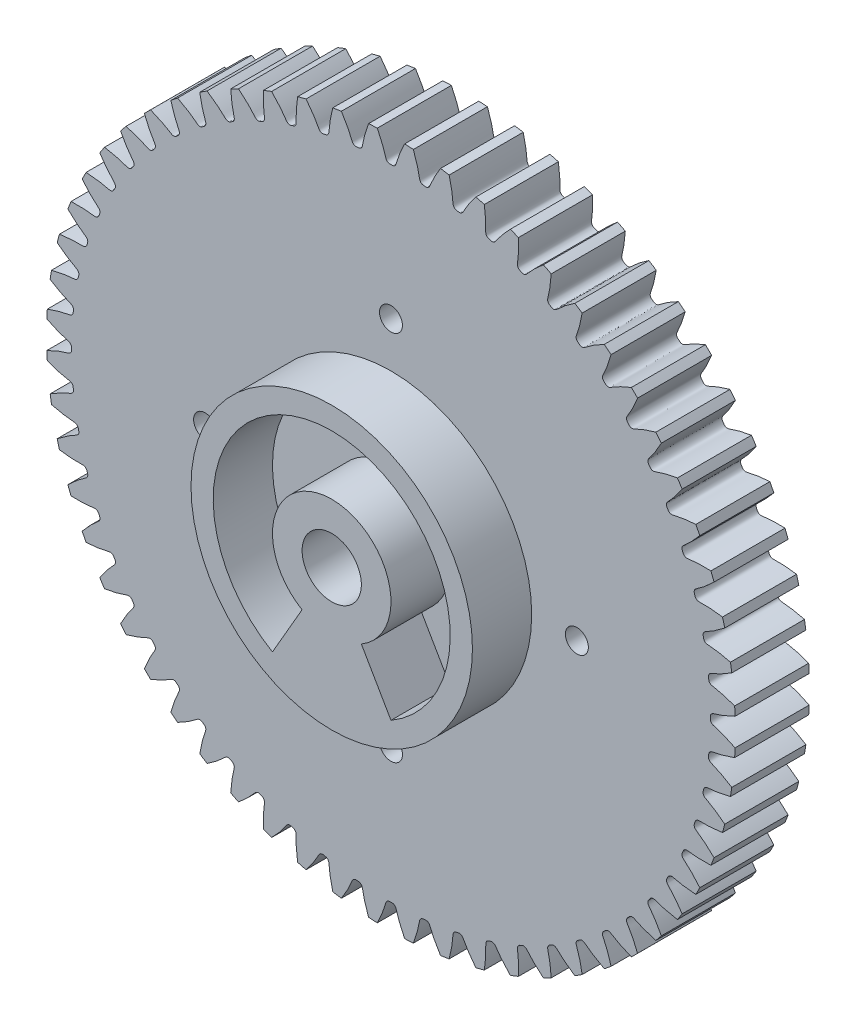
from build123d import *

# Parameters (mm, degrees)
SKETCHREVOLVESPURASSEMBLY01GEAR_W       = 10
SKETCHREVOLVESPURASSEMBLY01GEAR_H       = 46.499999302
TOOTHEXTRUDECUTSPURASSEMBLY01GEAR_DEPTH = 5
PATTERNSPURASSEMBLY01GEAR_COUNT         = 60
SKETCH4_R                               = 19
BOSS_EXTRUDE1_DEPTH                     = 8
SKETCH5_R                               = 4
CUT_EXTRUDE2_DEPTH                      = 18
SKETCH6_R                               = 1.55
CUT_EXTRUDE3_DEPTH                      = 10
CIRPATTERN2_COUNT                       = 4


with BuildPart() as part:
    # SketchRevolveSpurAssembly01Gear → SpurAssembly01Gear (revolve)
    with BuildSketch(Plane(origin=(0, 0, 0), x_dir=(0, 0, -1), z_dir=(1, 0, 0))):
        with Locations((0, 23.249999651)):
            Rectangle(SKETCHREVOLVESPURASSEMBLY01GEAR_W, SKETCHREVOLVESPURASSEMBLY01GEAR_H)
    revolve(axis=Axis((0, 0, 0), (0, 0, -1)))

    # SketchToothSpurAssembly01Gear → ToothExtrudeCutSpurAssembly01Gear (cut, symmetric)
    with BuildSketch(Plane.XY):
        with BuildLine():
            ThreePointArc((46.536941888, 1.882445097), (46.574999301, 0), (46.536941888, -1.882445097))
            add(Edge.make_bspline(
                [(46.536941888, -1.882445097), (46.410580772, -1.817790323), (46.222345848, -1.724049646), (45.97247157, -1.604862074), (45.79126821, -1.520902479), (45.613955508, -1.441140119), (45.440604048, -1.365477285), (45.271282713, -1.293815196), (45.106058665, -1.226054069), (44.944997361, -1.162093066), (44.788162422, -1.101830604), (44.635616032, -1.045163354), (44.487417476, -0.991989937), (44.343628263, -0.942197901), (44.204293895, -0.895710038), (44.06950835, -0.852320586), (43.939186277, -0.812273822), (43.755364294, -0.756463501), (43.591162201, -0.718537687), (43.456933301, -0.660411719), (43.396978032, -0.628409971), (43.333262239, -0.585604909), (43.264730377, -0.524892475), (43.194956481, -0.436129591), (43.140009905, -0.315401482), (43.119097636, -0.163510161), (43.128214427, 0), (43.119097636, 0.163510161), (43.140009905, 0.315401482), (43.194956481, 0.436129591), (43.264730377, 0.524892475), (43.333262239, 0.585604909), (43.396978032, 0.628409971), (43.456933301, 0.660411719), (43.591162201, 0.718537687), (43.755364294, 0.756463501), (43.939186277, 0.812273822), (44.06950835, 0.852320586), (44.204293895, 0.895710038), (44.343628263, 0.942197901), (44.487417476, 0.991989937), (44.635616032, 1.045163354), (44.788162422, 1.101830604), (44.944997361, 1.162093066), (45.106058665, 1.226054069), (45.271282713, 1.293815196), (45.440604048, 1.365477285), (45.613955508, 1.441140119), (45.79126821, 1.520902479), (45.97247157, 1.604862074), (46.222345848, 1.724049646), (46.410580772, 1.817790323), (46.536941888, 1.882445097)],
                knots=[0, 0, 0, 0, 0.05176586, 0.076685537, 0.100963046, 0.124598386, 0.147591557, 0.16994256, 0.191651394, 0.21271806, 0.233142557, 0.252924885, 0.272065045, 0.290563036, 0.308418859, 0.325632513, 0.342203998, 0.358133315, 0.395728589, 0.403326908, 0.411414611, 0.420483419, 0.431260975, 0.444674611, 0.46138654, 0.478964563, 0.5, 0.521035437, 0.53861346, 0.555325389, 0.568739025, 0.579516581, 0.588585389, 0.596673092, 0.604271411, 0.641866685, 0.657796002, 0.674367487, 0.691581141, 0.709436964, 0.727934955, 0.747075115, 0.766857443, 0.78728194, 0.808348606, 0.83005744, 0.852408443, 0.875401614, 0.899036954, 0.923314463, 0.94823414, 1, 1, 1, 1], degree=3))
        make_face()
    toothextrudecutspurassembly01gear = extrude(amount=TOOTHEXTRUDECUTSPURASSEMBLY01GEAR_DEPTH, both=True, mode=Mode.SUBTRACT)

    # PatternSpurAssembly01Gear: ToothExtrudeCutSpurAssembly01Gear ×60 about axis
    patternspurassembly01gear_axis = Axis((0, 0, 5.5), (0, 0, -1))
    for i in range(1, PATTERNSPURASSEMBLY01GEAR_COUNT):
        add(toothextrudecutspurassembly01gear.rotate(patternspurassembly01gear_axis, i * 360 / PATTERNSPURASSEMBLY01GEAR_COUNT), mode=Mode.SUBTRACT)

    # Sketch4 → Boss-Extrude1 (add)
    with BuildSketch(Plane.XY.offset(5)):
        Circle(SKETCH4_R)
        with BuildLine():
            Line((-4, -6.92820323), (-8, -13.856406461))
            ThreePointArc((-8, -13.856406461), (0, 16), (8, -13.856406461))
            Line((8, -13.856406461), (4, -6.92820323))
            ThreePointArc((4, -6.92820323), (0, 8), (-4, -6.92820323))
        make_face(mode=Mode.SUBTRACT)
    extrude(amount=BOSS_EXTRUDE1_DEPTH)

    # Sketch5 → Cut-Extrude2 (cut)
    with BuildSketch(Plane(origin=(0, 0, -5), x_dir=(-1, 0, 0), z_dir=(0, 0, -1))):
        Circle(SKETCH5_R)
    extrude(amount=-CUT_EXTRUDE2_DEPTH, mode=Mode.SUBTRACT)

    # Sketch6 → Cut-Extrude3 (cut)
    with BuildSketch(Plane(origin=(0, 0, -5), x_dir=(-1, 0, 0), z_dir=(0, 0, -1))):
        with Locations((25.1, 0)):
            Circle(SKETCH6_R)
    cut_extrude3 = extrude(amount=-CUT_EXTRUDE3_DEPTH, mode=Mode.SUBTRACT)

    # CirPattern2: Cut-Extrude3 ×4 about axis
    cirpattern2_axis = Axis((0, 0, 5.5), (0, 0, -1))
    for i in range(1, CIRPATTERN2_COUNT):
        add(cut_extrude3.rotate(cirpattern2_axis, i * 360 / CIRPATTERN2_COUNT), mode=Mode.SUBTRACT)


solid = part.part
